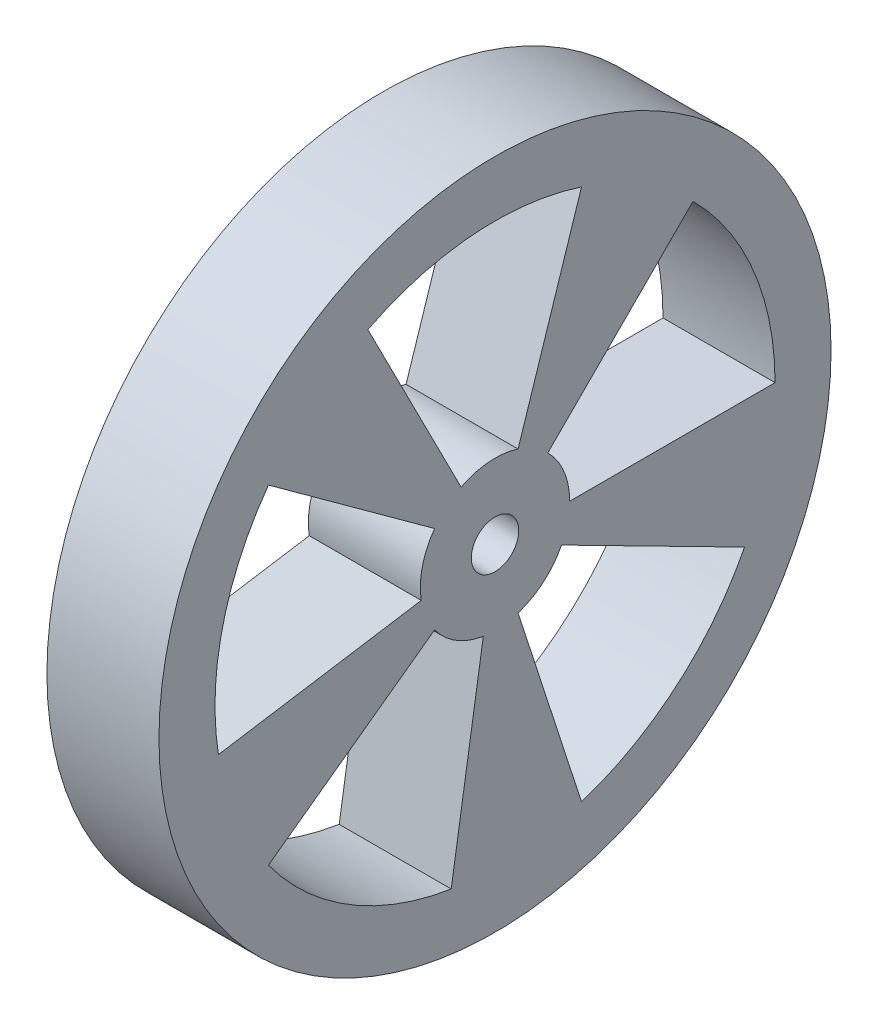
from build123d import *

# Parameters (mm, degrees)
SKETCH1_R           = 90
BOSS_EXTRUDE1_DEPTH = 30
SKETCH2_R           = 6.35
CUT_EXTRUDE2_DEPTH  = 131.766968306
CUT_EXTRUDE3_DEPTH  = 30
CIRPATTERN1_COUNT   = 5


with BuildPart() as part:
    # Sketch1 → Boss-Extrude1 (new body)
    with BuildSketch(Plane(origin=(0, 0, 0), x_dir=(0, 0, -1), z_dir=(1, 0, 0))):
        Circle(SKETCH1_R)
    extrude(amount=BOSS_EXTRUDE1_DEPTH)

    # Sketch2 → Cut-Extrude2 (cut, through all)
    with BuildSketch(Plane.ZY):
        Circle(SKETCH2_R)
    extrude(amount=-CUT_EXTRUDE2_DEPTH, mode=Mode.SUBTRACT)

    # Sketch3 → Cut-Extrude3 (cut)
    with BuildSketch(Plane.ZY):
        with BuildLine():
            Line((-20, 0), (-75, 0))
            ThreePointArc((-75, 0), (-69.290964938, 28.701257427), (-53.033008589, 53.033008589))
            Line((-53.033008589, 53.033008589), (-14.142135624, 14.142135624))
            ThreePointArc((-14.142135624, 14.142135624), (-18.47759065, 7.653668647), (-20, 0))
        make_face()
    cut_extrude3 = extrude(amount=-CUT_EXTRUDE3_DEPTH, mode=Mode.SUBTRACT)

    # CirPattern1: Cut-Extrude3 ×5 about axis
    cirpattern1_axis = Axis((30, 0, 0), (-1, 0, 0))
    for i in range(1, CIRPATTERN1_COUNT):
        add(cut_extrude3.rotate(cirpattern1_axis, i * 360 / CIRPATTERN1_COUNT), mode=Mode.SUBTRACT)


solid = part.part
